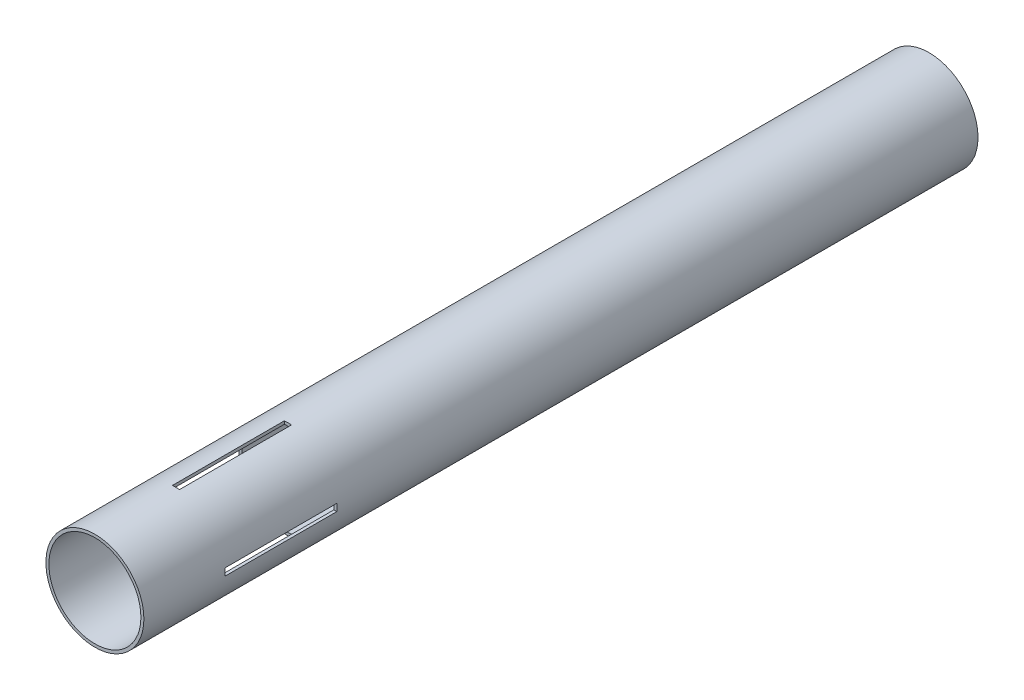
from build123d import *

# Parameters (mm, degrees)
SKETCH1_R           = 20.555
SKETCH1_R_2         = 19.305
BOSS_EXTRUDE3_DEPTH = 350
SKETCH2_W           = 47
SKETCH2_H           = 2
CUT_EXTRUDE1_DEPTH  = 1.5
CIRPATTERN1_COUNT   = 4


with BuildPart() as part:
    # Sketch1 → Boss-Extrude3 (new body)
    with BuildSketch(Plane.XY):
        Circle(SKETCH1_R)
        Circle(SKETCH1_R_2, mode=Mode.SUBTRACT)
    extrude(amount=-BOSS_EXTRUDE3_DEPTH)

    # Sketch2 → Cut-Extrude1 (cut, symmetric)
    with BuildSketch(Plane(origin=(0, 0, 0), x_dir=(0, 0, -1), z_dir=(1, 0, 0))):
        with Locations((57.5, 19.555)):
            Rectangle(SKETCH2_W, SKETCH2_H)
    cut_extrude1 = extrude(amount=CUT_EXTRUDE1_DEPTH, both=True, mode=Mode.SUBTRACT)

    # CirPattern1: Cut-Extrude1 ×4 about axis
    cirpattern1_axis = Axis((0, 0, -350), (0, 0, 1))
    for i in range(1, CIRPATTERN1_COUNT):
        add(cut_extrude1.rotate(cirpattern1_axis, i * 360 / CIRPATTERN1_COUNT), mode=Mode.SUBTRACT)


solid = part.part
